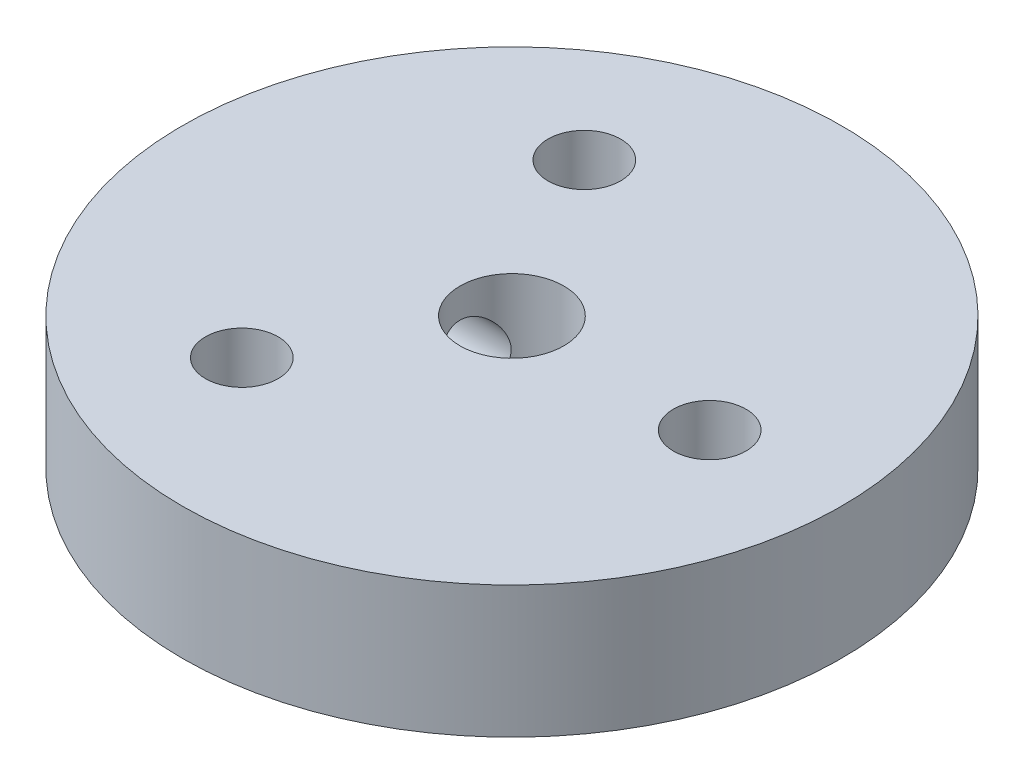
from build123d import *

# Parameters (mm, degrees)
SKETCH1_R           = 15.875
SKETCH1_R_2         = 2.499999953
SKETCH1_R_3         = 1.750000056
BOSS_EXTRUDE2_DEPTH = 3.175
SKETCH3_R           = 1.750000056
CUT_EXTRUDE1_DEPTH  = 23.674035261


with BuildPart() as part:
    # Sketch1 → Boss-Extrude2 (new, symmetric)
    with BuildSketch(Plane(origin=(0, 0, 0), x_dir=(1, 0, 0), z_dir=(0, 1, 0))):
        Circle(SKETCH1_R)
        Circle(SKETCH1_R_2, mode=Mode.SUBTRACT)
        with Locations((9.525, 0)):
            Circle(SKETCH1_R_3, mode=Mode.SUBTRACT)
        with Locations((-4.7625, -8.248891971)):
            Circle(SKETCH1_R_3, mode=Mode.SUBTRACT)
        with Locations((-4.7625, 8.248891971)):
            Circle(SKETCH1_R_3, mode=Mode.SUBTRACT)
    extrude(amount=BOSS_EXTRUDE2_DEPTH, both=True)

    # Sketch3 → Cut-Extrude1 (cut, through all)
    with BuildSketch(Plane(origin=(0, 0, 0), x_dir=(0, 0, -1), z_dir=(1, 0, 0))):
        Circle(SKETCH3_R)
    extrude(amount=-CUT_EXTRUDE1_DEPTH, mode=Mode.SUBTRACT)


solid = part.part
